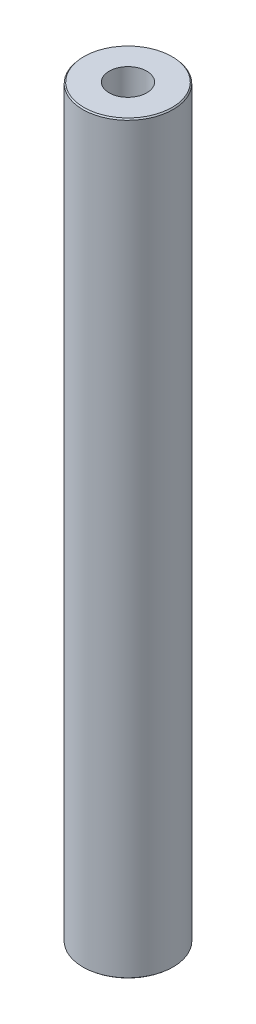
from build123d import *
from OCP.BRepFilletAPI import BRepFilletAPI_MakeChamfer

# Parameters (mm, degrees)
SKETCH1_R           = 20
BOSS_EXTRUDE1_DEPTH = 330.012456134
SKETCH2_R           = 8.336096475
CUT_EXTRUDE1_DEPTH  = 332.222313867
CHAMFER1_SIZE       = 0.568073471
CHAMFER1_SIZE2      = 0.475189108


with BuildPart() as part:
    # Sketch1 → Boss-Extrude1 (new body)
    with BuildSketch(Plane(origin=(0, 0, 0), x_dir=(1, 0, 0), z_dir=(0, 1, 0))):
        Circle(SKETCH1_R)
    extrude(amount=BOSS_EXTRUDE1_DEPTH)

    # Sketch2 → Cut-Extrude1 (cut, through all)
    with BuildSketch(Plane(origin=(0, 0, 0), x_dir=(1, 0, 0), z_dir=(0, 1, 0))):
        Circle(SKETCH2_R)
    extrude(amount=CUT_EXTRUDE1_DEPTH, mode=Mode.SUBTRACT)

    # Chamfer1: one chamfer whose edges measure the first distance from different faces: ONE call of the kernel's chamfer builder (chamfer() names one face for all edges)
    chamfer1_edges_1 = [part.edges().sort_by_distance(p)[0] for p in [
        (-20, 330.012456134, 0),
    ]]
    chamfer1_side_1 = [part.faces().sort_by_distance(p)[0] for p in [
        (-20, 165.006228067, 0),
    ]]
    chamfer1_edges_2 = [part.edges().sort_by_distance(p)[0] for p in [
        (-20, 0, 0),
    ]]
    chamfer1_side_2 = [part.faces().sort_by_distance(p)[0] for p in [
        (-19.434314575, 0, 0),
    ]]
    chamfer1 = BRepFilletAPI_MakeChamfer(part.part.solid().wrapped)
    for e in chamfer1_edges_1:
        chamfer1.Add(CHAMFER1_SIZE, CHAMFER1_SIZE2, e.wrapped, chamfer1_side_1[0].wrapped)  # the first distance lies on this face
    for e in chamfer1_edges_2:
        chamfer1.Add(CHAMFER1_SIZE, CHAMFER1_SIZE2, e.wrapped, chamfer1_side_2[0].wrapped)  # the first distance lies on this face
    add(Compound.cast(chamfer1.Shape()), mode=Mode.REPLACE)


solid = part.part
